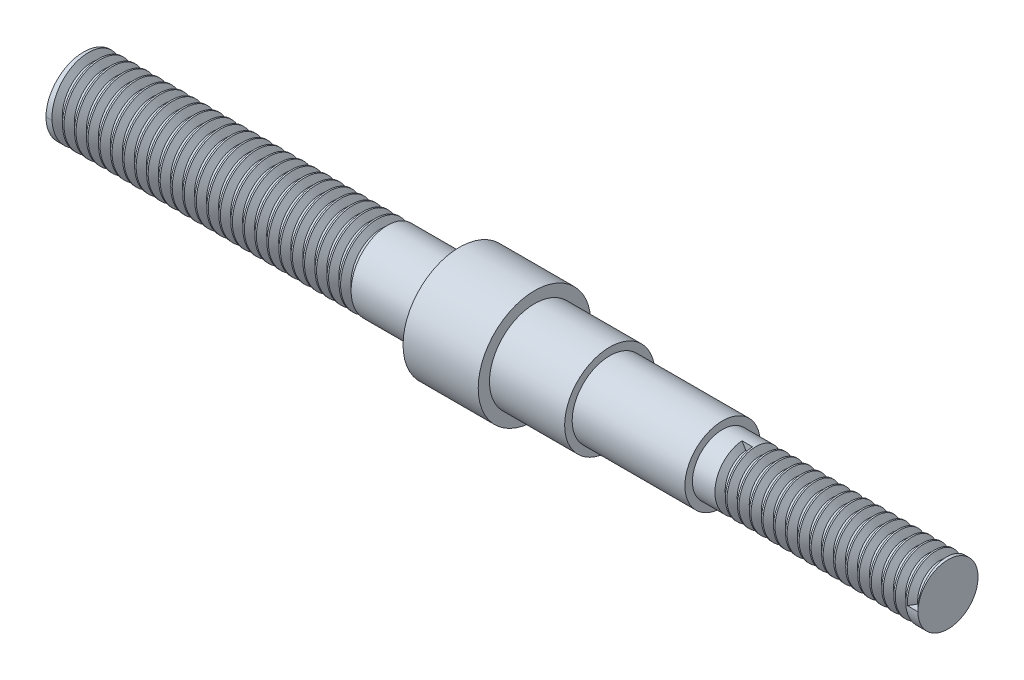
from build123d import *

# Parameters (mm, degrees)
THREAD1_PITCH = 0.8
THREAD2_PITCH = 0.8


with BuildPart() as part:
    # Sketch1 → Revolve1 (revolve)
    with BuildSketch(Plane.XY, mode=Mode.PRIVATE) as revolve1_sk:
        Polygon((-25, 0), (-25, 2.5), (0, 2.5), (0, 3.75), (5, 3.75), (5, 3), (10, 3), (10, 2.5), (17.5, 2.5), (17.5, 2), (32.5, 2), (32.5, 0), align=None)
    revolve(revolve1_sk.sketch.rotate(Axis((-24.765432099, 0, 0), (1, 0, 0)), 90), axis=Axis((-24.765432099, 0, 0), (1, 0, 0)))

    # Thread1: the profile of Thread Profile1 profile screwed along a right-hand helix of 25 turns, 8 arcs to a turn; built about Z, then put on its axis
    thread1_z = Axis((0, 0, 0), (0, 0, 1))
    thread1_corners = [(2.5003, 0, -0.000173205), (2.5003, 0, 0.700173203), (2.0669873, 0, 0.449999999), (2.0669873, 0, 0.249999999)]
    with BuildLine(mode=Mode.PRIVATE) as thread1_profile:
        Line(thread1_corners[0], thread1_corners[1])
        Line(thread1_corners[1], thread1_corners[2])
        Line(thread1_corners[2], thread1_corners[3])
        Line(thread1_corners[3], thread1_corners[0])
    thread1_cap = Face(thread1_profile.wire())
    thread1_turn_angles = [0, 22.5, 45, 67.5, 90, 112.5, 135, 157.5, 180, 202.5, 225, 247.5, 270, 292.5, 315, 337.5, 360]
    thread1_turn_weights = [1, 0.9238795325112867, 1, 0.9238795325112867, 1, 0.9238795325112867, 1, 0.9238795325112867, 1, 0.9238795325112867, 1, 0.9238795325112867, 1, 0.9238795325112867, 1, 0.9238795325112867, 1]
    thread1_turn_rails = [Edge.make_bspline([Vector(p[0], p[1], 0).rotate(thread1_z, thread1_turn_angles[k]) / thread1_turn_weights[k] + Vector(0, 0, p[2] + THREAD1_PITCH * thread1_turn_angles[k] / 360) for k in range(17)], [0, 0, 0, 1, 1, 2, 2, 3, 3, 4, 4, 5, 5, 6, 6, 7, 7, 8, 8, 8], 2, thread1_turn_weights) for p in thread1_corners]
    thread1_turn_sides = [Face.make_surface_from_curves(thread1_turn_rails[p[0]], thread1_turn_rails[p[1]]) for p in [(0, 1), (1, 2), (2, 3), (3, 0)]]
    thread1 = Plane(origin=(-25, 0, 0), x_dir=(0, 0, -1), z_dir=(1, 0, 0)) * Solid(Shell([*[p.moved(Location((0, 0, THREAD1_PITCH * i))) for i in range(25) for p in thread1_turn_sides], thread1_cap, thread1_cap.rotate(thread1_z, 9000).moved(Location((0, 0, THREAD1_PITCH * 9000 / 360)))]))
    add(thread1, mode=Mode.SUBTRACT)

    # Thread2: the profile of Thread Profile2 profile screwed along a right-hand helix of 16.25 turns, 8 arcs to a turn; built about Z, then put on its axis
    thread2_z = Axis((0, 0, 0), (0, 0, 1))
    thread2_corners = [(2.0003, 0, -0.000173205), (2.0003, 0, 0.700173203), (1.5669873, 0, 0.449999999), (1.5669873, 0, 0.249999999)]
    with BuildLine(mode=Mode.PRIVATE) as thread2_profile:
        Line(thread2_corners[0], thread2_corners[1])
        Line(thread2_corners[1], thread2_corners[2])
        Line(thread2_corners[2], thread2_corners[3])
        Line(thread2_corners[3], thread2_corners[0])
    thread2_cap = Face(thread2_profile.wire())
    thread2_turn_angles = [0, 22.5, 45, 67.5, 90, 112.5, 135, 157.5, 180, 202.5, 225, 247.5, 270, 292.5, 315, 337.5, 360]
    thread2_turn_weights = [1, 0.9238795325112867, 1, 0.9238795325112867, 1, 0.9238795325112867, 1, 0.9238795325112867, 1, 0.9238795325112867, 1, 0.9238795325112867, 1, 0.9238795325112867, 1, 0.9238795325112867, 1]
    thread2_turn_rails = [Edge.make_bspline([Vector(p[0], p[1], 0).rotate(thread2_z, thread2_turn_angles[k]) / thread2_turn_weights[k] + Vector(0, 0, p[2] + THREAD2_PITCH * thread2_turn_angles[k] / 360) for k in range(17)], [0, 0, 0, 1, 1, 2, 2, 3, 3, 4, 4, 5, 5, 6, 6, 7, 7, 8, 8, 8], 2, thread2_turn_weights) for p in thread2_corners]
    thread2_turn_sides = [Face.make_surface_from_curves(thread2_turn_rails[p[0]], thread2_turn_rails[p[1]]) for p in [(0, 1), (1, 2), (2, 3), (3, 0)]]
    thread2_last_angles = [5760, 5782.5, 5805, 5827.5, 5850]
    thread2_last_weights = [1, 0.9238795325112867, 1, 0.9238795325112867, 1]
    thread2_last_rails = [Edge.make_bspline([Vector(p[0], p[1], 0).rotate(thread2_z, thread2_last_angles[k]) / thread2_last_weights[k] + Vector(0, 0, p[2] + THREAD2_PITCH * thread2_last_angles[k] / 360) for k in range(5)], [0, 0, 0, 1, 1, 2, 2, 2], 2, thread2_last_weights) for p in thread2_corners]
    thread2_last_sides = [Face.make_surface_from_curves(thread2_last_rails[p[0]], thread2_last_rails[p[1]]) for p in [(0, 1), (1, 2), (2, 3), (3, 0)]]
    thread2 = Plane(origin=(32.5, 0, 0), x_dir=(0, 0, 1), z_dir=(-1, 0, 0)) * Solid(Shell([*[p.moved(Location((0, 0, THREAD2_PITCH * i))) for i in range(16) for p in thread2_turn_sides], *thread2_last_sides, thread2_cap, thread2_cap.rotate(thread2_z, 5850).moved(Location((0, 0, THREAD2_PITCH * 5850 / 360)))]))
    add(thread2, mode=Mode.SUBTRACT)


solid = part.part
